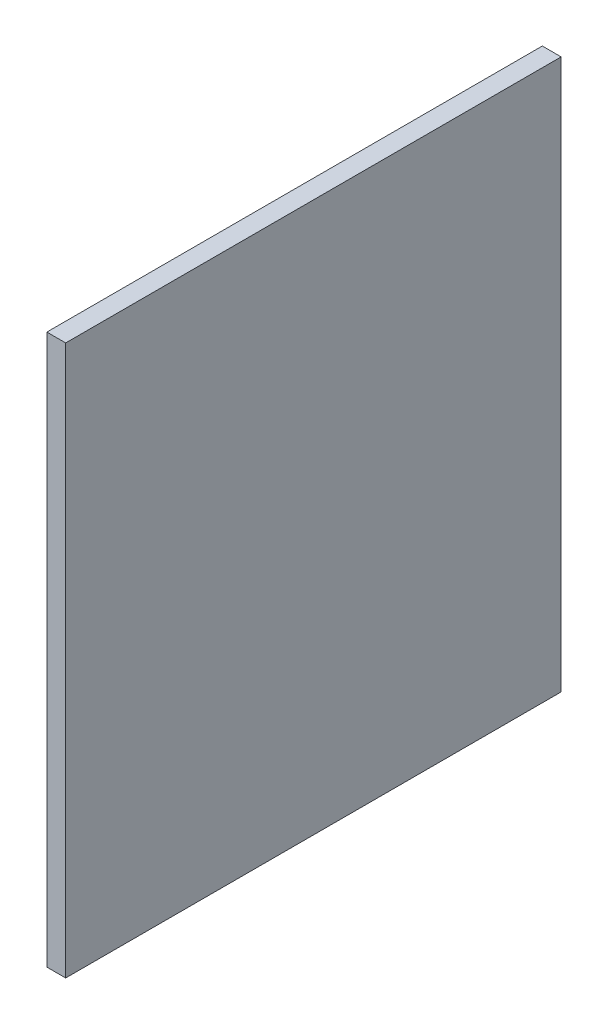
from build123d import *

# Parameters (mm, degrees)
SKETCH1_W           = 500
SKETCH1_H           = 555
BOSS_EXTRUDE1_DEPTH = 19


with BuildPart() as part:
    # Sketch1 → Boss-Extrude1 (new body)
    with BuildSketch(Plane(origin=(0, 0, 0), x_dir=(0, 0, -1), z_dir=(1, 0, 0))):
        with Locations((250, 277.5)):
            Rectangle(SKETCH1_W, SKETCH1_H)
    extrude(amount=BOSS_EXTRUDE1_DEPTH)


solid = part.part
